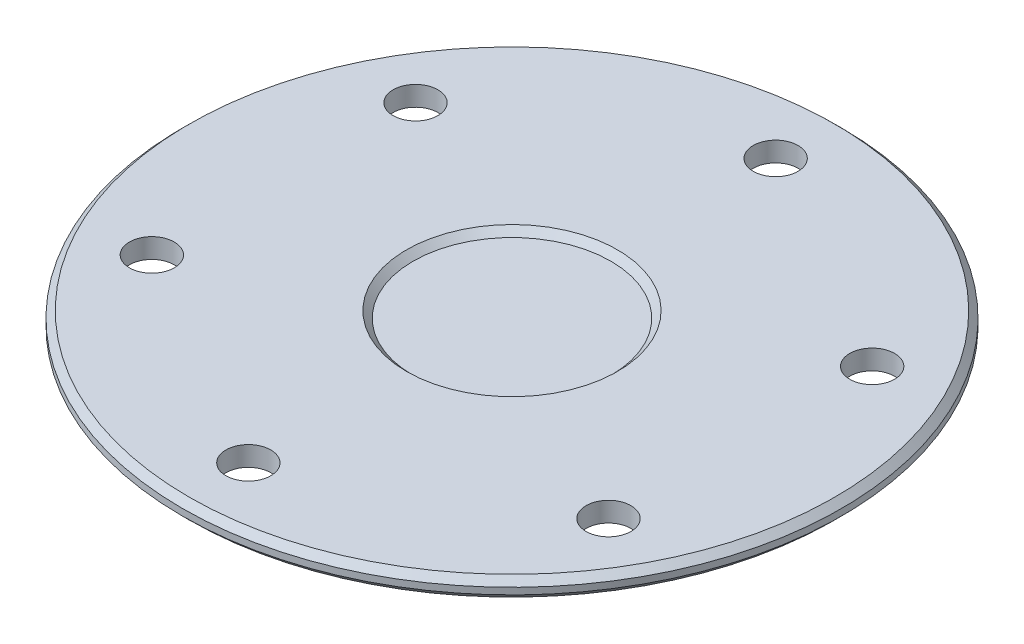
from build123d import *

# Parameters (mm, degrees)
SKETCH_1_R               = 50
EXTRUDE_1_DEPTH          = 3
PATTERN_CIRCULAR_1_COUNT = 6
SKETCH_5_R               = 15
CUT_EXTRUDE_1_DEPTH      = 1
CHAMFER_1_SIZE           = 1


with BuildPart() as part:
    # 草图1 → 凸台-拉伸1 (new body)
    with BuildSketch(Plane(origin=(0, 0, 0), x_dir=(1, 0, 0), z_dir=(0, 1, 0))):
        with Locations(Location((0, 0, 0), (0, 0, 270))):
            Circle(SKETCH_1_R)
    extrude(amount=EXTRUDE_1_DEPTH)

    # 草图4 → M8 螺纹孔的螺纹孔钻头1 (revolve, cut)
    with BuildSketch(Plane(origin=(0, 3, -40), x_dir=(0, 0, 1), z_dir=(1, 0, 0))):
        Polygon((0, 0), (0, 18.042926105), (3.4, 16), (3.4, 0), align=None)
    hole_wizard_m8_1 = revolve(axis=Axis((0, 9.35, -40), (0, -1, 0)), mode=Mode.SUBTRACT)

    # 阵列(圆周)1: M8 螺纹孔的螺纹孔钻头1 ×6 about axis
    pattern_circular_1_axis = Axis((0, 0, 0), (0, 1, 0))
    for i in range(1, PATTERN_CIRCULAR_1_COUNT):
        add(hole_wizard_m8_1.rotate(pattern_circular_1_axis, i * 360 / PATTERN_CIRCULAR_1_COUNT), mode=Mode.SUBTRACT)

    # 草图5 → 切除-拉伸1 (cut)
    with BuildSketch(Plane(origin=(0, 3, 0), x_dir=(1, 0, 0), z_dir=(0, 1, 0))):
        with Locations(Location((0, 0, 0), (0, 0, 270))):
            Circle(SKETCH_5_R)
    extrude(amount=-CUT_EXTRUDE_1_DEPTH, mode=Mode.SUBTRACT)

    # 倒角1
    chamfer_1_edges = [part.edges().sort_by_distance(p)[0] for p in [
        (0, 0, -50),
        (0, 3, -15),
        (0, 3, -50),
    ]]
    chamfer(chamfer_1_edges, length=CHAMFER_1_SIZE - 0.0001)  # a hair under: the kernel refuses the full size


solid = part.part
